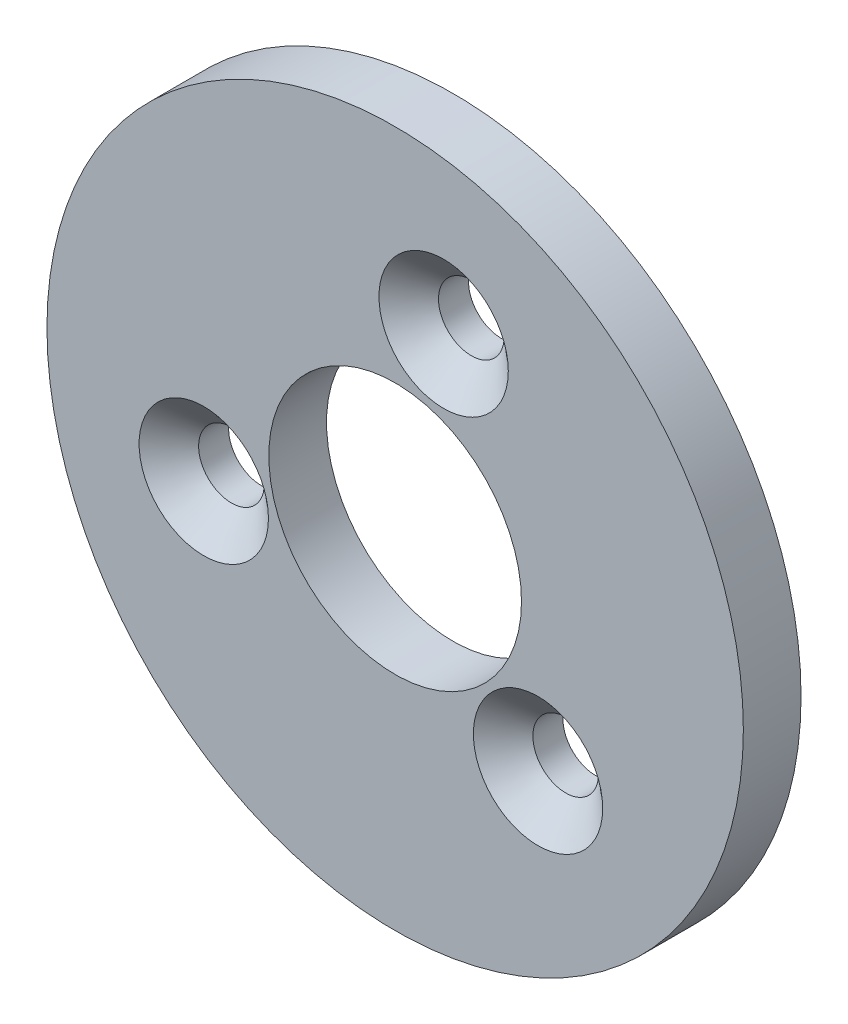
from build123d import *

# Parameters (mm, degrees)
SKETCH1_R           = 17.5
BOSS_EXTRUDE1_DEPTH = 2.9
SKETCH2_R           = 1.65
CUT_EXTRUDE1_DEPTH  = 25.918065736
CHAMFER1_SIZE       = 1.6
CHAMFER1_SIZE2      = 1.390858781
SKETCH3_R           = 6.35
CUT_EXTRUDE2_DEPTH  = 25.918065736


with BuildPart() as part:
    # Sketch1 → Boss-Extrude1 (new body)
    with BuildSketch(Plane.XY):
        Circle(SKETCH1_R)
    extrude(amount=BOSS_EXTRUDE1_DEPTH)

    # Sketch2 → Cut-Extrude1 (cut, through all)
    with BuildSketch(Plane.XY.offset(2.9)):
        with Locations((-9.61764005, -2.738795333)):
            Circle(SKETCH2_R)
        with Locations((7.180686359, -6.959722941)):
            Circle(SKETCH2_R)
        with Locations((2.436953691, 9.698518274)):
            Circle(SKETCH2_R)
    extrude(amount=-CUT_EXTRUDE1_DEPTH, mode=Mode.SUBTRACT)

    # Chamfer1
    chamfer1_edges = [part.edges().sort_by_distance(p)[0] for p in [
        (-11.26764005, -2.738795333, 2.9),
        (0.786953691, 9.698518274, 2.9),
        (5.530686359, -6.959722941, 2.9),
    ]]
    chamfer1_side = [part.faces().sort_by_distance(p)[0] for p in [
        (0, 0, 2.9),
    ]]
    chamfer(chamfer1_edges, length=CHAMFER1_SIZE, length2=CHAMFER1_SIZE2, reference=chamfer1_side[0])

    # Sketch3 → Cut-Extrude2 (cut, through all)
    with BuildSketch(Plane.XY.offset(2.9)):
        Circle(SKETCH3_R)
    extrude(amount=-CUT_EXTRUDE2_DEPTH, mode=Mode.SUBTRACT)


solid = part.part
